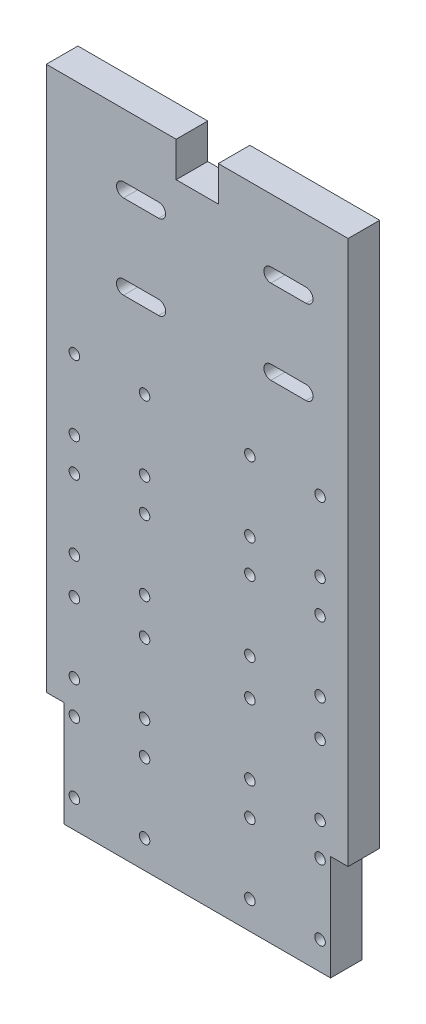
from build123d import *

# Parameters (mm, degrees)
ESQUISSE1_W             = 86
ESQUISSE1_H             = 185
BOSS_EXTRU_1_DEPTH      = 9
ESQUISSE2_R             = 1.5
ENL_V_MAT_EXTRU_1_DEPTH = 205.210675529
ESQUISSE3_R             = 1.5
ENL_V_MAT_EXTRU_2_DEPTH = 205.210675529
ESQUISSE4_W             = 5
ESQUISSE4_H             = 30
ENL_V_MAT_EXTRU_3_DEPTH = 205.210675529
ENL_V_MAT_EXTRU_4_DEPTH = 205.210675529
ESQUISSE7_W             = 12
ESQUISSE7_H             = 10
ENL_V_MAT_EXTRU_5_DEPTH = 205.210675529


with BuildPart() as part:
    # Esquisse1 → Boss.-Extru.1 (new body)
    with BuildSketch(Plane.XY):
        with Locations((43, 92.5)):
            Rectangle(ESQUISSE1_W, ESQUISSE1_H)
    extrude(amount=BOSS_EXTRU_1_DEPTH)

    # Esquisse2 → Enlèv. mat.-Extru.1 (cut, through all)
    with BuildSketch(Plane.XY.offset(9)):
        with Locations((8, 57.5)):
            Circle(ESQUISSE2_R)
        with Locations((28, 57.5)):
            Circle(ESQUISSE2_R)
        with Locations((28, 37.5)):
            Circle(ESQUISSE2_R)
        with Locations((8, 37.5)):
            Circle(ESQUISSE2_R)
        with Locations((78, 37.5)):
            Circle(ESQUISSE2_R)
        with Locations((58, 37.5)):
            Circle(ESQUISSE2_R)
        with Locations((58, 57.5)):
            Circle(ESQUISSE2_R)
        with Locations((78, 57.5)):
            Circle(ESQUISSE2_R)
        with Locations((78, 97.5)):
            Circle(ESQUISSE2_R)
        with Locations((58, 97.5)):
            Circle(ESQUISSE2_R)
        with Locations((58, 117.5)):
            Circle(ESQUISSE2_R)
        with Locations((78, 117.5)):
            Circle(ESQUISSE2_R)
        with Locations((8, 117.5)):
            Circle(ESQUISSE2_R)
        with Locations((28, 117.5)):
            Circle(ESQUISSE2_R)
        with Locations((28, 97.5)):
            Circle(ESQUISSE2_R)
        with Locations((8, 97.5)):
            Circle(ESQUISSE2_R)
    extrude(amount=-ENL_V_MAT_EXTRU_1_DEPTH, mode=Mode.SUBTRACT)

    # Esquisse3 → Enlèv. mat.-Extru.2 (cut, through all)
    with BuildSketch(Plane.XY.offset(9)):
        with Locations((8, 28)):
            Circle(ESQUISSE3_R)
        with Locations((8, 8)):
            Circle(ESQUISSE3_R)
        with Locations((28, 8)):
            Circle(ESQUISSE3_R)
        with Locations((28, 28)):
            Circle(ESQUISSE3_R)
        with Locations((28, 68)):
            Circle(ESQUISSE3_R)
        with Locations((28, 88)):
            Circle(ESQUISSE3_R)
        with Locations((8, 88)):
            Circle(ESQUISSE3_R)
        with Locations((8, 68)):
            Circle(ESQUISSE3_R)
        with Locations((78, 68)):
            Circle(ESQUISSE3_R)
        with Locations((78, 88)):
            Circle(ESQUISSE3_R)
        with Locations((58, 88)):
            Circle(ESQUISSE3_R)
        with Locations((58, 68)):
            Circle(ESQUISSE3_R)
        with Locations((58, 28)):
            Circle(ESQUISSE3_R)
        with Locations((58, 8)):
            Circle(ESQUISSE3_R)
        with Locations((78, 8)):
            Circle(ESQUISSE3_R)
        with Locations((78, 28)):
            Circle(ESQUISSE3_R)
    extrude(amount=-ENL_V_MAT_EXTRU_2_DEPTH, mode=Mode.SUBTRACT)

    # Esquisse4 → Enlèv. mat.-Extru.3 (cut, through all)
    with BuildSketch(Plane.XY.offset(9)):
        with Locations((2.5, 15)):
            Rectangle(ESQUISSE4_W, ESQUISSE4_H)
        with Locations((83.5, 15)):
            Rectangle(ESQUISSE4_W, ESQUISSE4_H)
    extrude(amount=-ENL_V_MAT_EXTRU_3_DEPTH, mode=Mode.SUBTRACT)

    # Esquisse6 → Enlèv. mat.-Extru.4 (cut, through all)
    with BuildSketch(Plane.XY.offset(9)):
        with BuildLine():
            Line((22, 167), (32, 167))
            ThreePointArc((32, 167), (34, 165), (32, 163))
            Line((32, 163), (22, 163))
            ThreePointArc((22, 163), (20, 165), (22, 167))
        make_face()
        with BuildLine():
            Line((22, 139), (32, 139))
            ThreePointArc((32, 139), (34, 141), (32, 143))
            Line((32, 143), (22, 143))
            ThreePointArc((22, 143), (20, 141), (22, 139))
        make_face()
        with BuildLine():
            Line((74, 167), (64, 167))
            ThreePointArc((64, 167), (62, 165), (64, 163))
            Line((64, 163), (74, 163))
            ThreePointArc((74, 163), (76, 165), (74, 167))
        make_face()
        with BuildLine():
            Line((74, 139), (64, 139))
            ThreePointArc((64, 139), (62, 141), (64, 143))
            Line((64, 143), (74, 143))
            ThreePointArc((74, 143), (76, 141), (74, 139))
        make_face()
    extrude(amount=-ENL_V_MAT_EXTRU_4_DEPTH, mode=Mode.SUBTRACT)

    # Esquisse7 → Enlèv. mat.-Extru.5 (cut, through all)
    with BuildSketch(Plane.XY.offset(9)):
        with Locations((43, 180)):
            Rectangle(ESQUISSE7_W, ESQUISSE7_H)
    extrude(amount=-ENL_V_MAT_EXTRU_5_DEPTH, mode=Mode.SUBTRACT)


solid = part.part
